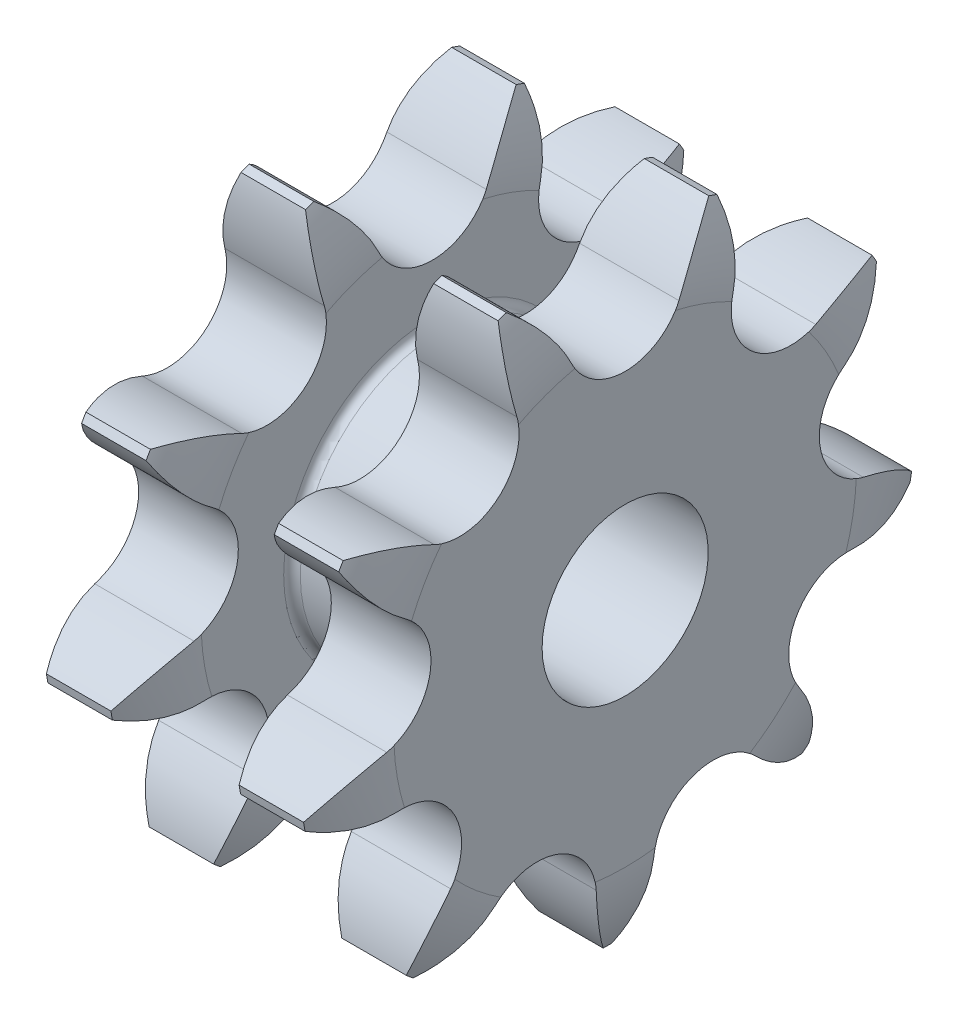
from build123d import *

# Parameters (mm, degrees)
TOOTHCUT_DEPTH  = 38.895381805
TEETHCUTS_COUNT = 9
TEETHCUTS_ANGLE = 320
BORSKE_R        = 6
BORE_DEPTH      = 23.3205


with BuildPart() as part:
    # BasProSke → Base-Revolve (revolve)
    with BuildSketch(Plane(origin=(0, 0, 0), x_dir=(1, 0, 0), z_dir=(0, 1, 0))):
        with BuildLine():
            Line((0, 0), (0, 16.712856303))
            ThreePointArc((0, 16.712856303), (0.321571182, 19.552662635), (1.27, 22.248657961))
            Line((1.27, 22.248657961), (19.85, 22.248657961))
            ThreePointArc((19.85, 22.248657961), (20.798428818, 19.552662635), (21.12, 16.712856303))
            Line((21.12, 16.712856303), (21.12, 0))
            Line((21.12, 0), (0, 0))
        make_face()
    revolve(axis=Axis((-10, 0, 0), (1, 0, 0)))

    # GrvSke → Groove (revolve, cut)
    with BuildSketch(Plane(origin=(0, 0, 0), x_dir=(1, 0, 0), z_dir=(0, 1, 0))):
        with BuildLine():
            Line((7.2, 16.712856303), (7.2, 10.751481635))
            ThreePointArc((7.2, 10.751481635), (7.375735931, 10.327217566), (7.8, 10.151481635))
            Line((7.8, 10.151481635), (13.32, 10.151481635))
            ThreePointArc((13.32, 10.151481635), (13.744264069, 10.327217566), (13.92, 10.751481635))
            Line((13.92, 10.751481635), (13.92, 16.712856303))
            ThreePointArc((13.92, 16.712856303), (14.241571182, 19.552662635), (15.19, 22.248657961))
            Line((15.19, 22.248657961), (5.93, 22.248657961))
            ThreePointArc((5.93, 22.248657961), (6.878428818, 19.552662635), (7.2, 16.712856303))
        make_face()
    revolve(axis=Axis((0, 0, 0), (1, 0, 0)), mode=Mode.SUBTRACT)

    # TooCutSke → ToothCut (cut, through all)
    with BuildSketch(Plane(origin=(0, 0, 0), x_dir=(0, 0, -1), z_dir=(1, 0, 0))):
        with BuildLine():
            ThreePointArc((3.89490303, 16.792484851), (5.53909395, 19.346647696), (7.807509589, 21.366895728))
            ThreePointArc((7.807509589, 21.366895728), (0, 22.748657961), (-7.807509589, 21.366895728))
            ThreePointArc((-7.807509589, 21.366895728), (-5.53909395, 19.346647696), (-3.89490303, 16.792484851))
            ThreePointArc((-3.89490303, 16.792484851), (0, 14.311157961), (3.89490303, 16.792484851))
        make_face()
    toothcut = extrude(amount=TOOTHCUT_DEPTH, mode=Mode.SUBTRACT)

    # TeethCuts: ToothCut ×9 about axis
    teethcuts_axis = Axis((-10, 0, 0), (1, 0, 0))
    for i in range(1, TEETHCUTS_COUNT):
        add(toothcut.rotate(teethcuts_axis, i * TEETHCUTS_ANGLE / (TEETHCUTS_COUNT - 1)), mode=Mode.SUBTRACT)

    # BorSke → Bore (cut, symmetric)
    with BuildSketch(Plane(origin=(0, 0, 0), x_dir=(0, 0, -1), z_dir=(1, 0, 0))):
        Circle(BORSKE_R)
    extrude(amount=BORE_DEPTH, both=True, mode=Mode.SUBTRACT)


solid = part.part
